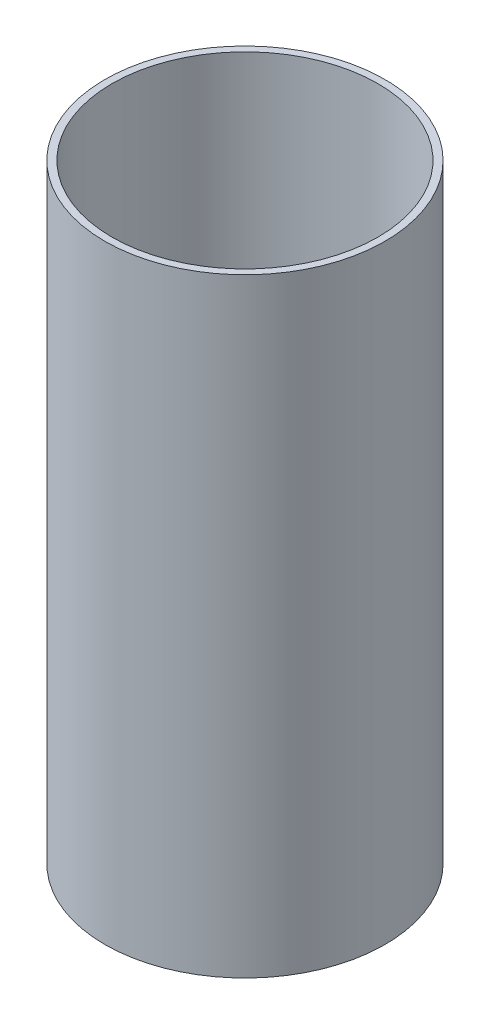
from build123d import *

# Parameters (mm, degrees)
SKETCH1_R           = 93.6625
SKETCH1_R_2         = 88.9
BOSS_EXTRUDE1_DEPTH = 203.581


with BuildPart() as part:
    # Sketch1 → Boss-Extrude1 (new, symmetric)
    with BuildSketch(Plane(origin=(0, 0, 0), x_dir=(1, 0, 0), z_dir=(0, 1, 0))):
        Circle(SKETCH1_R)
        Circle(SKETCH1_R_2, mode=Mode.SUBTRACT)
    extrude(amount=BOSS_EXTRUDE1_DEPTH, both=True)


solid = part.part
